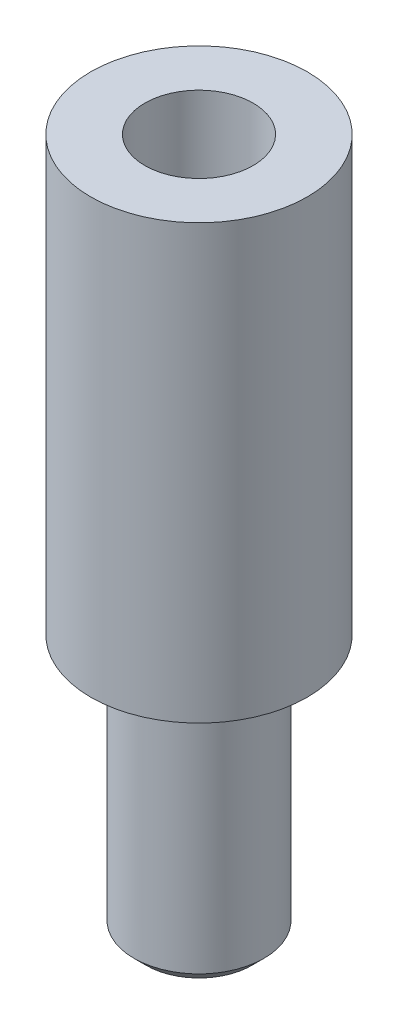
from build123d import *

# Parameters (mm, degrees)
M3_TAPPED_HOLE1_D     = 2.5
M3_TAPPED_HOLE1_DEPTH = 7.748924226
M3_TAPPED_HOLE1_TIP   = 0.751075774


# Read off the part's stored shape, not the designer's step: M3 Machine Threads Stud1
with BuildPart() as part:
    # Sketch2 → Revolve1 (revolve)
    with BuildSketch(Plane.XY, mode=Mode.PRIVATE) as revolve1_sk:
        Polygon((0, 0), (1.5, 0), (1.5, 6), (2.5, 6), (2.5, 16), (0, 16), align=None)
    revolve(revolve1_sk.sketch.rotate(Axis((0, 0, 0), (0, 1, 0)), 90), axis=Axis((0, 0, 0), (0, 1, 0)))

    # M3 Machine Threads Stud1 outline → M3 Machine Threads Stud1 (revolve, cut)
    with BuildSketch(Plane.XY):
        Polygon((1.5, 0.2805), (1.2195, 0), (1.5, 0), align=None)
    revolve(axis=Axis((0, 0, 0), (0, 1, 0)), mode=Mode.SUBTRACT)

    # M3 Tapped Hole1
    with Locations(Plane(origin=(0, 16, 0), x_dir=(1, 0, 0), z_dir=(0, 1, 0))):
        with Locations((0, 0)):
            Hole(M3_TAPPED_HOLE1_D / 2, depth=M3_TAPPED_HOLE1_DEPTH)
            with Locations((0, 0, -(M3_TAPPED_HOLE1_DEPTH + M3_TAPPED_HOLE1_TIP / 2))):  # 118° drill point
                Cone(0, M3_TAPPED_HOLE1_D / 2, M3_TAPPED_HOLE1_TIP, mode=Mode.SUBTRACT)


solid = part.part
